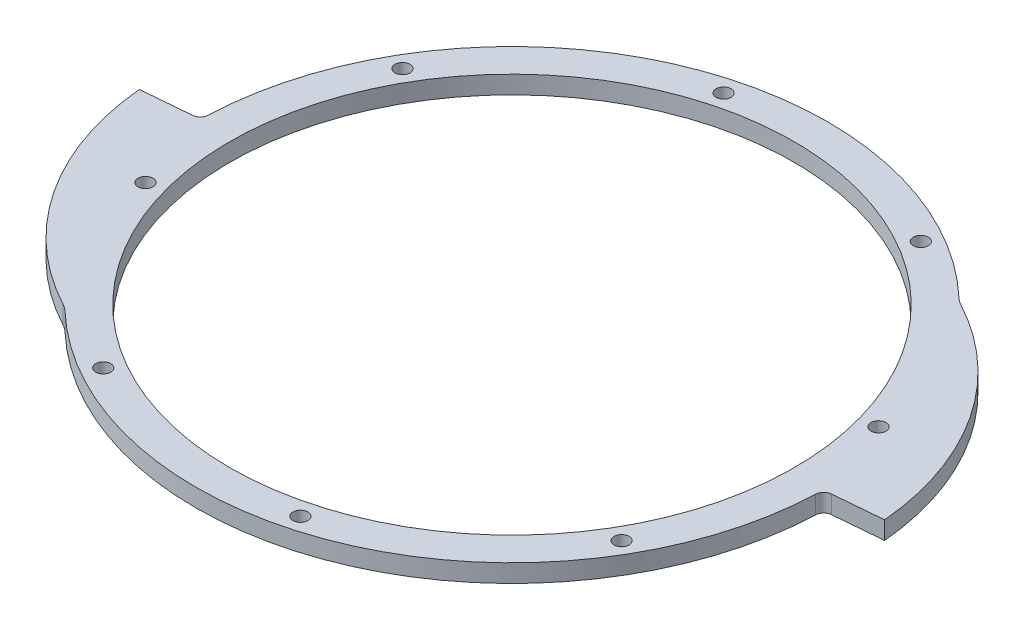
from build123d import *

# Parameters (mm, degrees)
SKETCH1_R                = 100
BOSS_EXTRUDE1_DEPTH      = 3.175
FILLET1_R                = 3
CIRPATTERN1_COUNT        = 2
FILLET1_OF_CIRPATTERN1_R = 3
SKETCH2_R                = 2.65
CUT_EXTRUDE1_DEPTH       = 174.229104079
CIRPATTERN2_COUNT        = 8


with BuildPart() as part:
    # Sketch1 → Boss-Extrude1 (new, symmetric)
    with BuildSketch(Plane(origin=(0, 0, 0), x_dir=(1, 0, 0), z_dir=(0, 1, 0))):
        with BuildLine():
            Line((-111.986312116, 1.750970805), (-132, 0))
            ThreePointArc((-132, 0), (-115.815804966, -46.398149165), (-79.477414809, -79.477414809))
            ThreePointArc((-79.477414809, -79.477414809), (-78.32708198, -80.19539315), (-77.284459499, -81.062397694))
            ThreePointArc((-77.284459499, -81.062397694), (103.297481806, 43.285450818), (-111.986312116, 1.750970805))
        make_face()
        Circle(SKETCH1_R, mode=Mode.SUBTRACT)
    boss_extrude1 = extrude(amount=BOSS_EXTRUDE1_DEPTH, both=True)

    # Fillet1
    fillet1_edges = [part.edges().sort_by_distance(p)[0] for p in [
        (-111.986312116, 0, -1.750970805),
    ]]
    fillet(fillet1_edges, radius=FILLET1_R)

    # CirPattern1: Boss-Extrude1 ×2 about axis
    cirpattern1_axis = Axis((0, 3.175, 0), (0, -1, 0))
    for i in range(1, CIRPATTERN1_COUNT):
        add(boss_extrude1.rotate(cirpattern1_axis, i * 360 / CIRPATTERN1_COUNT))

    # Fillet1 of CirPattern1
    fillet1_of_cirpattern1_edges = [part.edges().sort_by_distance(p)[0] for p in [
        (111.986312116, 0, 1.750970805),
    ]]
    fillet(fillet1_of_cirpattern1_edges, radius=FILLET1_OF_CIRPATTERN1_R)

    # Sketch2 → Cut-Extrude1 (cut, through all)
    with BuildSketch(Plane(origin=(0, 3.175, 0), x_dir=(1, 0, 0), z_dir=(0, 1, 0))):
        with Locations((-102.388137587, -27.434818781)):
            Circle(SKETCH2_R)
    cut_extrude1 = extrude(amount=-CUT_EXTRUDE1_DEPTH, mode=Mode.SUBTRACT)

    # CirPattern2: Cut-Extrude1 ×8 about axis
    cirpattern2_axis = Axis((0, 3.175, 0), (0, -1, 0))
    for i in range(1, CIRPATTERN2_COUNT):
        add(cut_extrude1.rotate(cirpattern2_axis, i * 360 / CIRPATTERN2_COUNT), mode=Mode.SUBTRACT)


solid = part.part
